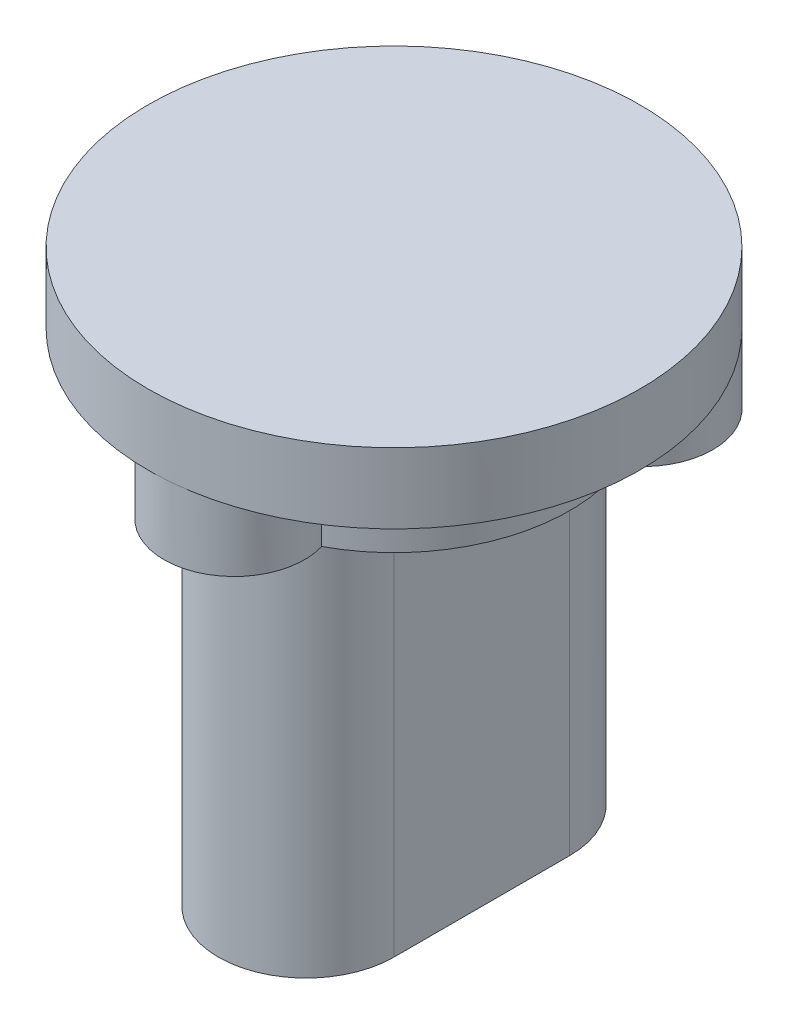
from build123d import *

# Parameters (mm, degrees)
BOSS_EXTRUDE1_DEPTH = 13
BOSS_EXTRUDE2_DEPTH = 2
SKETCH1_4_R         = 7
BOSS_EXTRUDE3_DEPTH = 2


with BuildPart() as part:
    # Sketch1 → Boss-Extrude1 (new body)
    with BuildSketch(Plane(origin=(0, 0, 0), x_dir=(1, 0, 0), z_dir=(0, 1, 0))):
        with BuildLine():
            Line((2.5, 2.5), (2.5, -2.5))
            ThreePointArc((2.5, -2.5), (0, -5), (-2.5, -2.5))
            Line((-2.5, -2.5), (-2.5, 2.5))
            ThreePointArc((-2.5, 2.5), (0, 5), (2.5, 2.5))
        make_face()
    extrude(amount=-BOSS_EXTRUDE1_DEPTH)

    # Sketch1<3> → Boss-Extrude2 (add)
    with BuildSketch(Plane(origin=(0, 0, 0), x_dir=(1, 0, 0), z_dir=(0, 1, 0))):
        with BuildLine():
            ThreePointArc((1.867050547, 4.63833184), (-1.710100717, 4.698463104), (-4.411705933, 2.353051372))
            ThreePointArc((-4.411705933, 2.353051372), (-6.973362887, 0.610090199), (-4.75328529, -1.551218539))
            ThreePointArc((-4.75328529, -1.551218539), (-3.535533906, -3.535533906), (-1.551218539, -4.75328529))
            ThreePointArc((-1.551218539, -4.75328529), (0.610090199, -6.973362887), (2.353051372, -4.411705933))
            ThreePointArc((2.353051372, -4.411705933), (4.698463104, -1.710100717), (4.63833184, 1.867050547))
            ThreePointArc((4.63833184, 1.867050547), (4.949747468, 4.949747468), (1.867050547, 4.63833184))
        make_face()
    extrude(amount=-BOSS_EXTRUDE2_DEPTH)

    # Sketch1<4> → Boss-Extrude3 (add)
    with BuildSketch(Plane(origin=(0, 0, 0), x_dir=(1, 0, 0), z_dir=(0, 1, 0))):
        Circle(SKETCH1_4_R)
    extrude(amount=BOSS_EXTRUDE3_DEPTH)


solid = part.part
